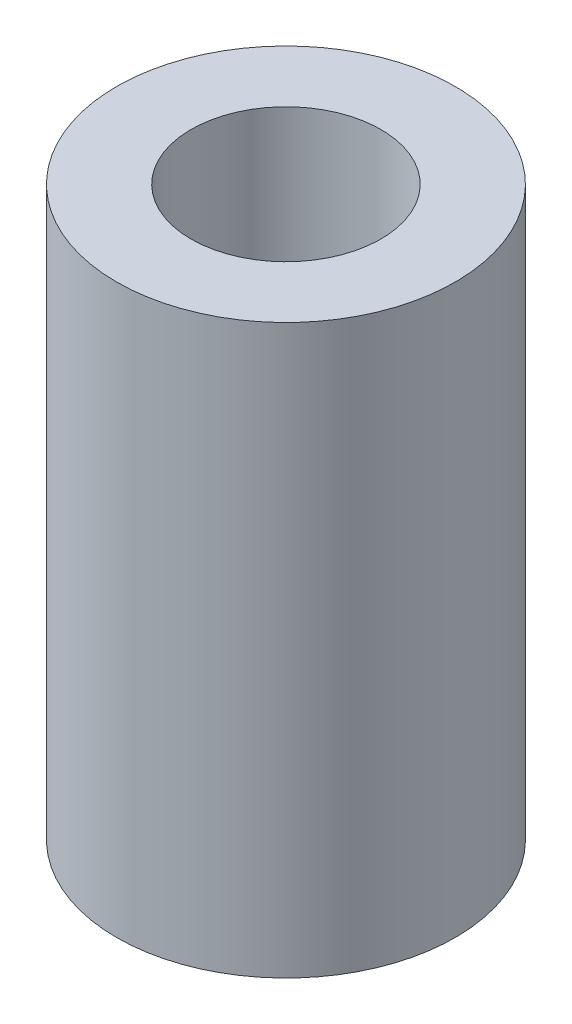
from build123d import *

# Parameters (mm, degrees)
SKETCH1_R           = 7.5
BOSS_EXTRUDE1_DEPTH = 25.144771566
SKETCH2_R           = 4.205202205
CUT_EXTRUDE1_DEPTH  = 28.290282833


with BuildPart() as part:
    # Sketch1 → Boss-Extrude1 (new body)
    with BuildSketch(Plane(origin=(0, 0, 0), x_dir=(1, 0, 0), z_dir=(0, 1, 0))):
        Circle(SKETCH1_R)
    extrude(amount=BOSS_EXTRUDE1_DEPTH)

    # Sketch2 → Cut-Extrude1 (cut, through all)
    with BuildSketch(Plane(origin=(0, 0, 0), x_dir=(1, 0, 0), z_dir=(0, 1, 0))):
        Circle(SKETCH2_R)
    extrude(amount=CUT_EXTRUDE1_DEPTH, mode=Mode.SUBTRACT)


solid = part.part
